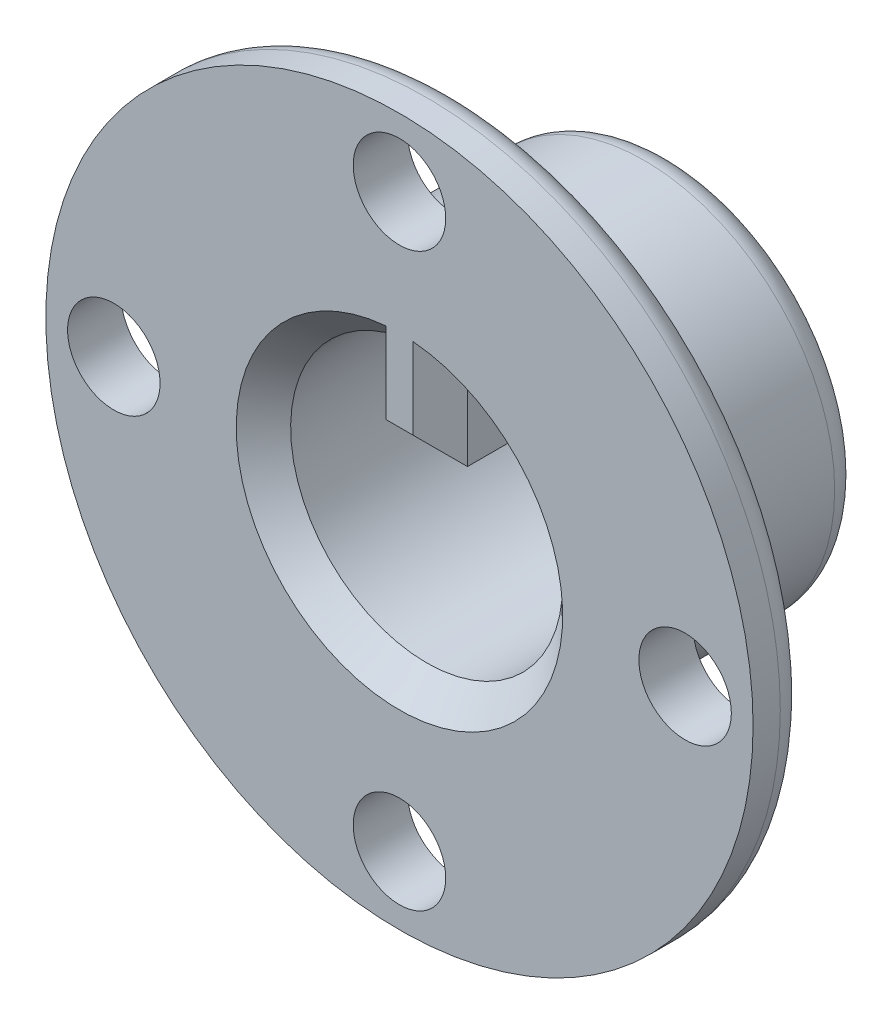
from build123d import *

# Parameters (mm, degrees)
CROQUIS1_R                   = 7
SALIENTE_EXTRUIR1_DEPTH      = 10
CROQUIS1_3_R                 = 13
CROQUIS1_3_R_2               = 7
SALIENTE_EXTRUIR2_DEPTH      = 2
TALADRO_DE_MARGEN_PARA_M31_D = 3.4
CHAFL_N1_SIZE                = 1
REDONDEO2_R                  = 1
CHAFL_N2_SIZE                = 1


with BuildPart() as part:
    # Croquis1 → Saliente-Extruir1 (new body)
    # profile 1 of 5: a face of its own
    with BuildSketch(Plane.XY):
        Circle(CROQUIS1_R)
        with BuildLine():
            Line((-1.5, 5), (0, 5))
            Line((0, 5), (1.5, 5))
            Line((1.5, 5), (1.5, 4.769696007))
            ThreePointArc((1.5, 4.769696007), (4.031128874, 2.958039892), (5, 0))
            ThreePointArc((5, 0), (-2.958039892, -4.031128874), (-1.5, 4.769696007))
            Line((-1.5, 4.769696007), (-1.5, 5))
        make_face(mode=Mode.SUBTRACT)
    # profile 2 of 5: a face of its own
    with BuildSketch(Plane.XY):
        with BuildLine():
            Line((0, 5), (0, 2))
            Line((0, 2), (1.5, 2))
            Line((1.5, 2), (1.5, 4.769696007))
            ThreePointArc((1.5, 4.769696007), (0.758788496, 4.942088629), (0, 5))
        make_face()
    # profile 3 of 5: a face of its own
    with BuildSketch(Plane.XY):
        with BuildLine():
            Line((-1.5, 2), (0, 2))
            Line((0, 2), (0, 5))
            ThreePointArc((0, 5), (-0.758788496, 4.942088629), (-1.5, 4.769696007))
            Line((-1.5, 4.769696007), (-1.5, 2))
        make_face()
    # profile 4 of 5: a face of its own
    with BuildSketch(Plane.XY):
        with BuildLine():
            Line((1.5, 5), (0, 5))
            ThreePointArc((0, 5), (0.758788496, 4.942088629), (1.5, 4.769696007))
            Line((1.5, 4.769696007), (1.5, 5))
        make_face()
    # profile 5 of 5: a face of its own
    with BuildSketch(Plane.XY):
        with BuildLine():
            ThreePointArc((-1.5, 4.769696007), (-0.758788496, 4.942088629), (0, 5))
            Line((0, 5), (-1.5, 5))
            Line((-1.5, 5), (-1.5, 4.769696007))
        make_face()
    extrude(amount=-SALIENTE_EXTRUIR1_DEPTH)

    # Croquis1<3> → Saliente-Extruir2 (add)
    with BuildSketch(Plane.XY):
        Circle(CROQUIS1_3_R)
        Circle(CROQUIS1_3_R_2, mode=Mode.SUBTRACT)
    extrude(amount=-SALIENTE_EXTRUIR2_DEPTH)

    # Taladro de margen para M31 (through all)
    with Locations(Plane.XY):
        with Locations((0, 10.5), (10.5, 0), (0, -10.5), (-10.5, 0), (0, 0)):
            Hole(TALADRO_DE_MARGEN_PARA_M31_D / 2)

    # Chaflán1
    chafl_n1_edges = [part.edges().sort_by_distance(p)[0] for p in [
        (-1.5, 3.384848004, -10),
        (0, 2, -10),
        (1.5, 3.384848004, -10),
        (0, -5, -10),
    ]]
    chamfer(chafl_n1_edges, length=CHAFL_N1_SIZE)

    # Redondeo2
    # the kernel refuses this fillet: 1 mm, written as the material it adds along each edge
    with BuildSketch(Plane(origin=(0, 0, -2), x_dir=(1, 0, 0), z_dir=(0, -1, 0))) as redondeo2_piece_1:
        with BuildLine():
            CenterArc((7 + REDONDEO2_R, -REDONDEO2_R), REDONDEO2_R, 90, 90)
            Line((7 + REDONDEO2_R, 0), (7, 0))
            Line((7, 0), (7, -REDONDEO2_R))
        make_face()
    revolve(axis=Axis((0, 0, -2), (0, 0, 1)))
    # the kernel refuses this fillet: 1 mm, written as the material it takes off along each edge
    with BuildSketch(Plane(origin=(0, 0, -2), x_dir=(1, 0, 0), z_dir=(0, -1, 0))) as redondeo2_2_piece_1:
        with BuildLine():
            CenterArc((13 - REDONDEO2_R, REDONDEO2_R), REDONDEO2_R, 270, 90)
            Line((13, REDONDEO2_R), (13, 0))
            Line((13, 0), (13 - REDONDEO2_R, 0))
        make_face()
    revolve(axis=Axis((0, 0, -2), (0, 0, 1)), mode=Mode.SUBTRACT)
    with BuildSketch(Plane(origin=(0, 0, -10), x_dir=(1, 0, 0), z_dir=(0, -1, 0))) as redondeo2_2_piece_2:
        with BuildLine():
            CenterArc((7 - REDONDEO2_R, REDONDEO2_R), REDONDEO2_R, 270, 90)
            Line((7, REDONDEO2_R), (7, 0))
            Line((7, 0), (7 - REDONDEO2_R, 0))
        make_face()
    revolve(axis=Axis((0, 0, -10), (0, 0, 1)), mode=Mode.SUBTRACT)

    # Chaflán2
    chafl_n2_edges = [part.edges().sort_by_distance(p)[0] for p in [
        (1.5, 3.384848004, 0),
        (0, 2, 0),
        (-1.5, 3.384848004, 0),
        (0, -5, 0),
    ]]
    chamfer(chafl_n2_edges, length=CHAFL_N2_SIZE)


solid = part.part
